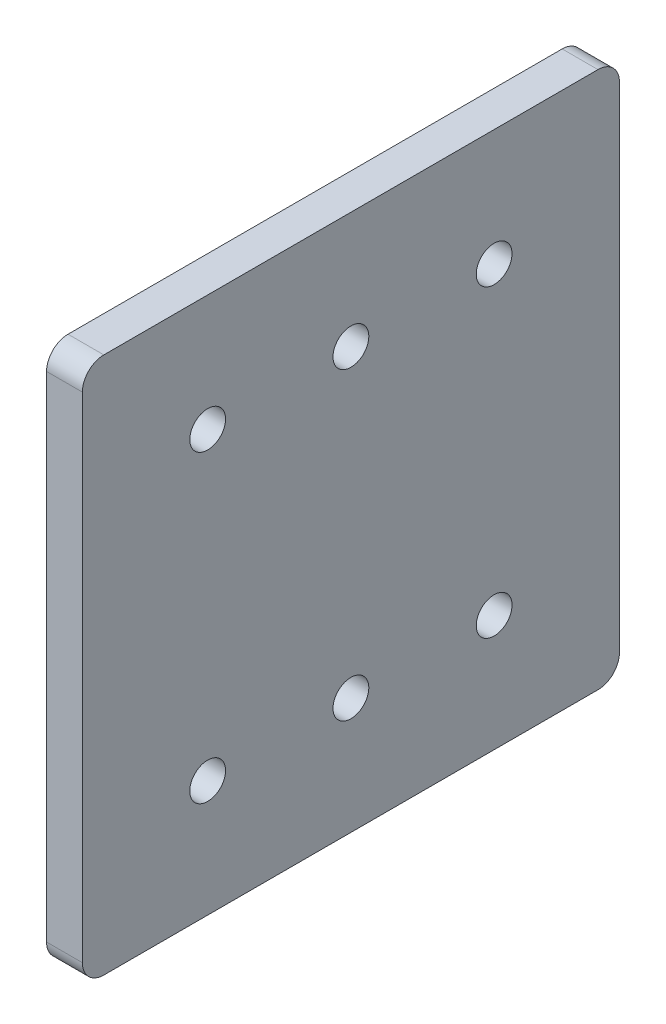
from build123d import *

# Parameters (mm, degrees)
STOCK_MASTER_SKETCH_002_1_START     = 413
STOCK_MASTER_SKETCH_002_1_OUTLINE_W = 75
STOCK_MASTER_SKETCH_002_1_OUTLINE_H = 75
STOCK_MASTER_SKETCH_002_1_OUTLINE_R = 2.5
STOCK_MASTER_SKETCH_002_1_DEPTH     = 5
FILLET1_R                           = 3


# Read off the part's stored shape, not the designer's step: Stock-master_sketch_002-1
with BuildPart() as part:
    # Stock-master_sketch_002-1 outline → Stock-master_sketch_002-1 (new body)
    with BuildSketch(Plane.YZ.offset(STOCK_MASTER_SKETCH_002_1_START)):
        with Locations((0, 1880)):
            Rectangle(STOCK_MASTER_SKETCH_002_1_OUTLINE_W, STOCK_MASTER_SKETCH_002_1_OUTLINE_H)
        with Locations((-21.25, 1860)):
            Circle(STOCK_MASTER_SKETCH_002_1_OUTLINE_R, mode=Mode.SUBTRACT)
        with Locations((21.25, 1860)):
            Circle(STOCK_MASTER_SKETCH_002_1_OUTLINE_R, mode=Mode.SUBTRACT)
        with Locations((-21.25, 1880)):
            Circle(STOCK_MASTER_SKETCH_002_1_OUTLINE_R, mode=Mode.SUBTRACT)
        with Locations((-21.25, 1900)):
            Circle(STOCK_MASTER_SKETCH_002_1_OUTLINE_R, mode=Mode.SUBTRACT)
        with Locations((21.25, 1880)):
            Circle(STOCK_MASTER_SKETCH_002_1_OUTLINE_R, mode=Mode.SUBTRACT)
        with Locations((21.25, 1900)):
            Circle(STOCK_MASTER_SKETCH_002_1_OUTLINE_R, mode=Mode.SUBTRACT)
    extrude(amount=STOCK_MASTER_SKETCH_002_1_DEPTH)

    # Fillet1
    fillet1_edges = [part.edges().sort_by_distance(p)[0] for p in [
        (415.5, 37.5, 1917.5),
        (415.5, 37.5, 1842.5),
        (415.5, -37.5, 1842.5),
        (415.5, -37.5, 1917.5),
    ]]
    fillet(fillet1_edges, radius=FILLET1_R)


solid = part.part
